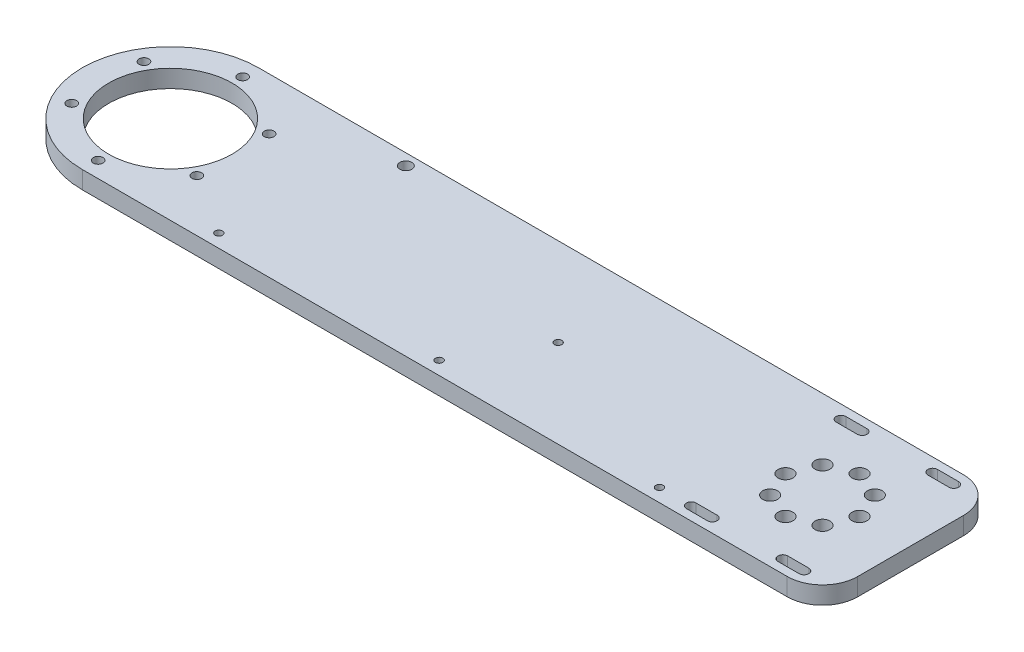
from build123d import *

# Parameters (mm, degrees)
SCHIZZO1_W                   = 470
SCHIZZO1_H                   = 100
SCHIZZO1_R                   = 35
ESTRUSIONE_ESTRUSIONE1_DEPTH = 5
FORO_PER_VITE_M8_1_D         = 8.5
RIPETIZIONECIRCOLARE1_COUNT  = 8
SCHIZZO6_R                   = 28
TAGLIO_ESTRUSIONE1_DEPTH     = 3
SMUSSO1_SIZE                 = 0.5
SCHIZZO7_R                   = 2.75
TAGLIO_ESTRUSIONE2_DEPTH     = 424.083916026
RIPETIZIONECIRCOLARE2_COUNT  = 6
RACCORDO1_R                  = 20
RACCORDO2_R                  = 50
TAGLIO_ESTRUSIONE3_START     = -10
TAGLIO_ESTRUSIONE3_DEPTH     = 4
SCHIZZO10_R                  = 2.1
TAGLIO_ESTRUSIONE4_DEPTH     = 424.083916026
SCHIZZO11_R                  = 3.4
TAGLIO_ESTRUSIONE5_DEPTH     = 10
SCHIZZO12_R                  = 2.1
TAGLIO_ESTRUSIONE6_DEPTH     = 424.083916026
TAGLIO_ESTRUSIONE7_DEPTH     = 424.008274151


with BuildPart() as part:
    # Schizzo1 → Estrusione-Estrusione1 (new, symmetric)
    with BuildSketch(Plane(origin=(0, 0, 0), x_dir=(1, 0, 0), z_dir=(0, 1, 0))):
        with Locations((-185, 0)):
            Rectangle(SCHIZZO1_W, SCHIZZO1_H)
        with Locations(Location((-370, 0, 0), (0, 0, 270))):
            Circle(SCHIZZO1_R, mode=Mode.SUBTRACT)
    extrude(amount=ESTRUSIONE_ESTRUSIONE1_DEPTH, both=True)

    # Foro per Vite M8-1 (through all)
    with Locations(Plane(origin=(0, 5, 0), x_dir=(1, 0, 0), z_dir=(0, 1, 0))):
        with Locations((21, 0)):
            foro_per_vite_m8_1 = Hole(FORO_PER_VITE_M8_1_D / 2)

    # RipetizioneCircolare1: Foro per Vite M8-1 ×8 about axis
    ripetizionecircolare1_axis = Axis((0, 0, 0), (0, 1, 0))
    for i in range(1, RIPETIZIONECIRCOLARE1_COUNT):
        add(foro_per_vite_m8_1.rotate(ripetizionecircolare1_axis, i * 360 / RIPETIZIONECIRCOLARE1_COUNT), mode=Mode.SUBTRACT)

    # Schizzo6 → Taglio-Estrusione1 (cut)
    with BuildSketch(Plane.XZ.offset(5)):
        with Locations(Location((0, 0, 0), (0, 0, 270))):
            Circle(SCHIZZO6_R)
    extrude(amount=-TAGLIO_ESTRUSIONE1_DEPTH, mode=Mode.SUBTRACT)

    # Smusso1
    smusso1_edges = [part.edges().sort_by_distance(p)[0] for p in [
        (0, -5, 28),
    ]]
    chamfer(smusso1_edges, length=SMUSSO1_SIZE)

    # Schizzo7 → Taglio-Estrusione2 (cut, through all)
    with BuildSketch(Plane(origin=(0, 5, 0), x_dir=(1, 0, 0), z_dir=(0, 1, 0))):
        with Locations(Location((-370, 41, 0), (0, 0, 270))):
            Circle(SCHIZZO7_R)
    taglio_estrusione2 = extrude(amount=-TAGLIO_ESTRUSIONE2_DEPTH, mode=Mode.SUBTRACT)

    # RipetizioneCircolare2: Taglio-Estrusione2 ×6 about axis
    ripetizionecircolare2_axis = Axis((-370, 0, 0), (0, 1, 0))
    for i in range(1, RIPETIZIONECIRCOLARE2_COUNT):
        add(taglio_estrusione2.rotate(ripetizionecircolare2_axis, i * 360 / RIPETIZIONECIRCOLARE2_COUNT), mode=Mode.SUBTRACT)

    # Raccordo1
    raccordo1_edges = [part.edges().sort_by_distance(p)[0] for p in [
        (50, 0, -50),
        (50, 0, 50),
    ]]
    fillet(raccordo1_edges, radius=RACCORDO1_R)

    # Raccordo2
    raccordo2_edges = [part.edges().sort_by_distance(p)[0] for p in [
        (-420, 0, -50),
        (-420, 0, 50),
    ]]
    fillet(raccordo2_edges, radius=RACCORDO2_R - 0.0001)  # a hair under: the kernel refuses the full size

    # Schizzo9 → Taglio-Estrusione3 (cut)
    with BuildSketch(Plane(origin=(0, 5, 0), x_dir=(1, 0, 0), z_dir=(0, 1, 0)).offset(TAGLIO_ESTRUSIONE3_START)):
        with BuildLine():
            Line((-32, 46.55), (-20, 46.55))
            ThreePointArc((-20, 46.55), (-15.95, 42.5), (-20, 38.45))
            Line((-20, 38.45), (-32, 38.45))
            ThreePointArc((-32, 38.45), (-36.05, 42.5), (-32, 46.55))
        make_face()
        with BuildLine():
            Line((20, 46.55), (32, 46.55))
            ThreePointArc((32, 46.55), (36.05, 42.5), (32, 38.45))
            Line((32, 38.45), (20, 38.45))
            ThreePointArc((20, 38.45), (15.95, 42.5), (20, 46.55))
        make_face()
        with BuildLine():
            Line((-32, -38.45), (-20, -38.45))
            ThreePointArc((-20, -38.45), (-15.95, -42.5), (-20, -46.55))
            Line((-20, -46.55), (-32, -46.55))
            ThreePointArc((-32, -46.55), (-36.05, -42.5), (-32, -38.45))
        make_face()
        with BuildLine():
            Line((20, -38.45), (32, -38.45))
            ThreePointArc((32, -38.45), (36.05, -42.5), (32, -46.55))
            Line((32, -46.55), (20, -46.55))
            ThreePointArc((20, -46.55), (15.95, -42.5), (20, -38.45))
        make_face()
    extrude(amount=TAGLIO_ESTRUSIONE3_DEPTH, mode=Mode.SUBTRACT)

    # Schizzo10 → Taglio-Estrusione4 (cut, through all)
    with BuildSketch(Plane(origin=(0, 5, 0), x_dir=(1, 0, 0), z_dir=(0, 1, 0))):
        with Locations(Location((-150, 0, 0), (0, 0, 270))):
            Circle(SCHIZZO10_R)
    extrude(amount=-TAGLIO_ESTRUSIONE4_DEPTH, mode=Mode.SUBTRACT)

    # Schizzo11 → Taglio-Estrusione5 (cut)
    with BuildSketch(Plane(origin=(0, 5, 0), x_dir=(1, 0, 0), z_dir=(0, 1, 0))):
        with Locations(Location((-280, 43.588989435, 0), (0, 0, 270))):
            Circle(SCHIZZO11_R)
    extrude(amount=-TAGLIO_ESTRUSIONE5_DEPTH, mode=Mode.SUBTRACT)

    # Schizzo12 → Taglio-Estrusione6 (cut, through all)
    with BuildSketch(Plane(origin=(0, 5, 0), x_dir=(1, 0, 0), z_dir=(0, 1, 0))):
        with Locations(Location((-50, -42.5, 0), (0, 0, 270))):
            Circle(SCHIZZO12_R)
        with Locations(Location((-300, -42.5, 0), (0, 0, 270))):
            Circle(SCHIZZO12_R)
        with Locations(Location((-175, -42.5, 0), (0, 0, 270))):
            Circle(SCHIZZO12_R)
    extrude(amount=-TAGLIO_ESTRUSIONE6_DEPTH, mode=Mode.SUBTRACT)

    # Schizzo13 → Taglio-Estrusione7 (cut, through all)
    with BuildSketch(Plane(origin=(0, -1, 0), x_dir=(-1, 0, 0), z_dir=(0, -1, 0))):
        with BuildLine():
            Line((32, -45.25), (20, -45.25))
            ThreePointArc((20, -45.25), (17.25, -42.5), (20, -39.75))
            Line((20, -39.75), (32, -39.75))
            ThreePointArc((32, -39.75), (34.75, -42.5), (32, -45.25))
        make_face()
        with BuildLine():
            Line((-20, -45.25), (-32, -45.25))
            ThreePointArc((-32, -45.25), (-34.75, -42.5), (-32, -39.75))
            Line((-32, -39.75), (-20, -39.75))
            ThreePointArc((-20, -39.75), (-17.25, -42.5), (-20, -45.25))
        make_face()
        with BuildLine():
            Line((-32, 45.25), (-20, 45.25))
            ThreePointArc((-20, 45.25), (-17.25, 42.5), (-20, 39.75))
            Line((-20, 39.75), (-32, 39.75))
            ThreePointArc((-32, 39.75), (-34.75, 42.5), (-32, 45.25))
        make_face()
        with BuildLine():
            Line((20, 45.25), (32, 45.25))
            ThreePointArc((32, 45.25), (34.75, 42.5), (32, 39.75))
            Line((32, 39.75), (20, 39.75))
            ThreePointArc((20, 39.75), (17.25, 42.5), (20, 45.25))
        make_face()
    extrude(amount=-TAGLIO_ESTRUSIONE7_DEPTH, mode=Mode.SUBTRACT)


solid = part.part
